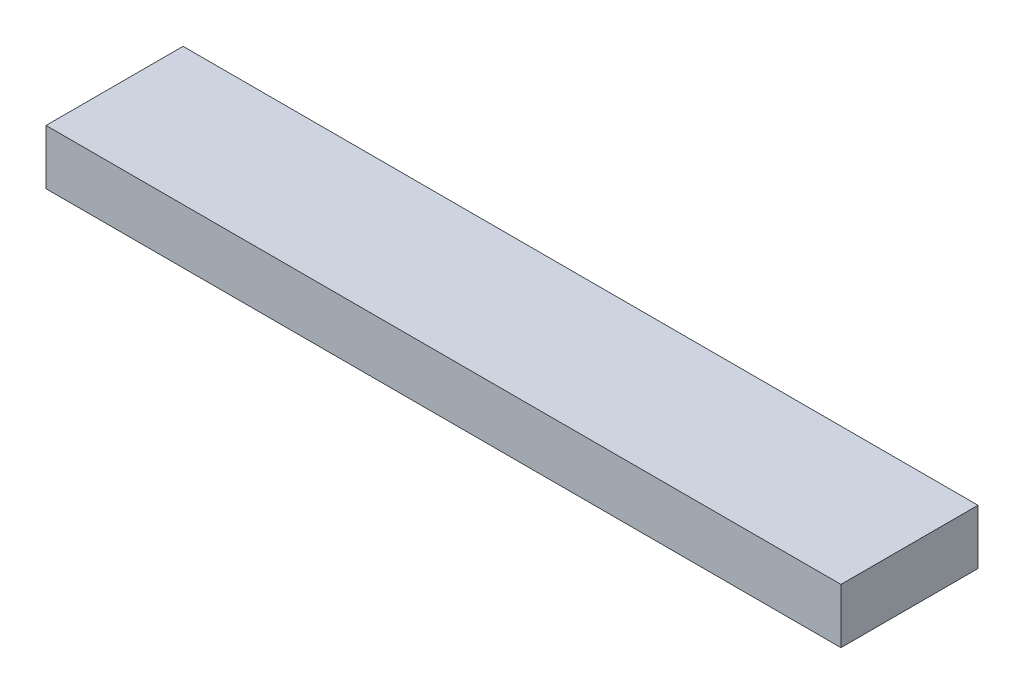
from build123d import *

# Parameters (mm, degrees)
SKETCH_1_W      = 145
SKETCH_1_H      = 25
EXTRUDE_1_DEPTH = 10


with BuildPart() as part:
    # Эскиз1 → Бобышка-Вытянуть1 (new body)
    with BuildSketch(Plane(origin=(0, 0, 0), x_dir=(1, 0, 0), z_dir=(0, 1, 0))):
        with Locations((72.5, 12.5)):
            Rectangle(SKETCH_1_W, SKETCH_1_H)
    extrude(amount=EXTRUDE_1_DEPTH)


solid = part.part
